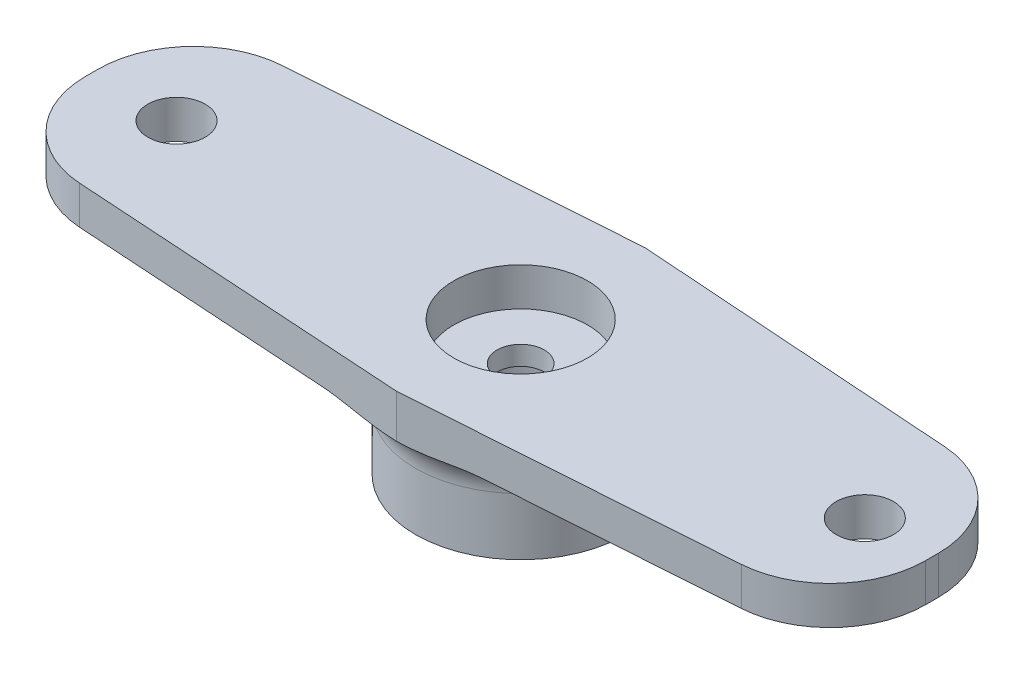
from build123d import *

# Parameters (mm, degrees)
SKETCH1_R           = 3.5
SKETCH1_R_2         = 1.5
BOSS_EXTRUDE1_DEPTH = 2
FILLET2_R           = 5
SKETCH2_R           = 5.5
SKETCH2_R_2         = 1.235500329
BOSS_EXTRUDE2_DEPTH = 5
FILLET3_R           = 2
CUT_EXTRUDE1_START  = -5
SKETCH3_R           = 3
CUT_EXTRUDE1_DEPTH  = 4


with BuildPart() as part:
    # Sketch1 → Boss-Extrude1 (new body)
    with BuildSketch(Plane(origin=(0, 0, 0), x_dir=(1, 0, 0), z_dir=(0, 1, 0))):
        Polygon((0, 6.5), (-22.384997637, 4.939274727), (-22.384997637, -5.060725273), (0, -6.5), (21.514033914, -5), (21.514033914, 5), align=None)
        with Locations(Location((0, 0, 0), (0, 0, 270))):
            Circle(SKETCH1_R, mode=Mode.SUBTRACT)
        with Locations(Location((-18, 0, 0), (0, 0, 270))):
            Circle(SKETCH1_R_2, mode=Mode.SUBTRACT)
        with Locations(Location((18, 0, 0), (0, 0, 270))):
            Circle(SKETCH1_R_2, mode=Mode.SUBTRACT)
    extrude(amount=BOSS_EXTRUDE1_DEPTH)

    # Fillet2
    fillet2_edges = [part.edges().sort_by_distance(p)[0] for p in [
        (-22.384997637, 1, 5.060725273),
        (-22.384997637, 1, -4.939274727),
        (21.514033914, 1, -5),
        (21.514033914, 1, 5),
    ]]
    fillet(fillet2_edges, radius=FILLET2_R)

    # Sketch2 → Boss-Extrude2 (add)
    with BuildSketch(Plane(origin=(0, 0, 0), x_dir=(1, 0, 0), z_dir=(0, 1, 0))):
        with Locations(Location((0, 0, 0), (0, 0, 270))):
            Circle(SKETCH2_R)
        with Locations(Location((0, 0, 0), (0, 0, 270))):
            Circle(SKETCH2_R_2, mode=Mode.SUBTRACT)
    extrude(amount=-BOSS_EXTRUDE2_DEPTH)

    # Fillet3
    # the kernel refuses this fillet: 2 mm, written as the material it adds along each edge
    with BuildSketch(Plane(origin=(0, 0, 0), x_dir=(0, 0, 1), z_dir=(-1, 0, 0))) as fillet3_piece_1_section:
        with BuildLine():
            CenterArc((5.5 + FILLET3_R, -FILLET3_R), FILLET3_R, 90, 90)
            Line((5.5, -FILLET3_R), (5.5, 0))
            Line((5.5, 0), (5.5 + FILLET3_R, 0))
        make_face()
    fillet3_piece_1 = revolve(axis=Axis((0, 0, 0), (0, 1, 0)), mode=Mode.PRIVATE)
    fillet3_piece_1 = split(fillet3_piece_1, bisect_by=Plane(origin=(-0.030373147, -0.562249721, -6.497882326), z_dir=(0.06955308260096395, 0, 0.9975782519184666)), keep=Keep.TOP, mode=Mode.PRIVATE)
    fillet3_piece_1 = split(fillet3_piece_1, bisect_by=Plane(origin=(0.030373147, -0.562249721, -6.497882326), z_dir=(-0.06955308260096384, 0, 0.9975782519184666)), keep=Keep.TOP, mode=Mode.PRIVATE)
    fillet3_piece_1 = split(fillet3_piece_1, bisect_by=Plane(origin=(-0.804382076, -0.562249721, 6.44828113), z_dir=(0.06416390756024656, 0, -0.9979393733922919)), keep=Keep.TOP, mode=Mode.PRIVATE)
    fillet3_piece_1 = split(fillet3_piece_1, bisect_by=Plane(origin=(0.871627207, -0.562249721, 6.439228468), z_dir=(-0.06955308260096384, 0, -0.9975782519184666)), keep=Keep.TOP, mode=Mode.PRIVATE)
    add(fillet3_piece_1)

    # Sketch3 → Cut-Extrude1 (cut)
    with BuildSketch(Plane(origin=(0, 0, 0), x_dir=(1, 0, 0), z_dir=(0, 1, 0)).offset(CUT_EXTRUDE1_START)):
        with Locations(Location((0, 0, 0), (0, 0, 270))):
            Circle(SKETCH3_R)
    extrude(amount=CUT_EXTRUDE1_DEPTH, mode=Mode.SUBTRACT)


solid = part.part
